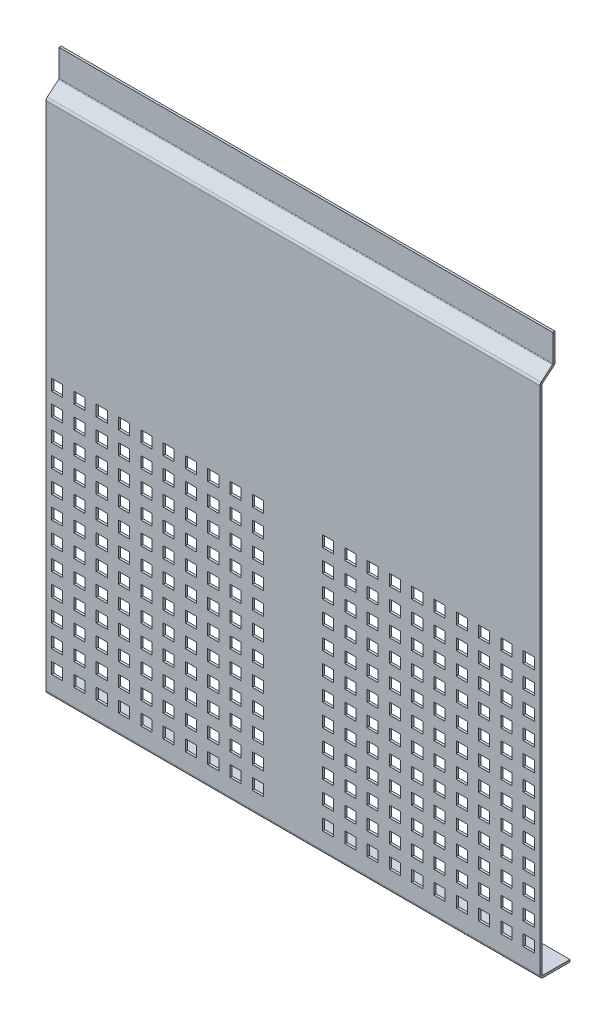
from build123d import *

# Parameters (mm, degrees)
SKETCH1_W                    = 443
SKETCH1_H                    = 500
BASE_FLANGE1_DEPTH           = 2
SKETCHED_START               = -221.5
SKETCHED_BEND1_DEPTH         = 443
SKETCHED_BEND1_2_DEPTH       = 443
SKETCHED_BEND2_DEPTH         = 443
SKETCHED_BEND2_2_DEPTH       = 443
EDGE_FLANGE1_STRIP_W         = 10
EDGE_FLANGE1_STRIP_H         = 2
EDGE_FLANGE1_STRIP_CUT_DEPTH = 443
EDGE_FLANGE1_DEPTH           = 443
SKETCH13_W                   = 10
SKETCH13_H                   = 10
CUT_EXTRUDE2_DEPTH           = 10
SKETCH13_4_W                 = 10
SKETCH13_4_H                 = 10
CUT_EXTRUDE3_DEPTH           = 10
CUT_EXTRUDE4_DEPTH           = 10


# Read off the part's stored shape, not the designer's step: Sketched Bend1, Sketched Bend2
# Sheet-metal steps are written as plain solids
with BuildPart() as part:
    # Sketch1 → Base-Flange1 (new body)
    with BuildSketch(Plane.XY):
        Rectangle(SKETCH1_W, SKETCH1_H)
    extrude(amount=-BASE_FLANGE1_DEPTH)

    # Sketched Bend1 outline → Sketched Bend1 (cut)
    with BuildSketch(Plane.YZ.offset(SKETCHED_START)):
        with BuildLine():
            Line((211.425468703, -1.071637171), (212.20445761, -2))
            Line((212.20445761, -2), (250, -2))
            Line((250, -2), (250, 0))
            Line((250, 0), (209.127335374, 0))
            ThreePointArc((209.127335374, 0), (210.395190159, -0.281076639), (211.425468703, -1.071637171))
        make_face()
    extrude(amount=SKETCHED_BEND1_DEPTH, mode=Mode.SUBTRACT)

    # Sketched Bend1 2 outline → Sketched Bend1 2 (add)
    with BuildSketch(Plane.YZ.offset(SKETCHED_START)):
        with BuildLine():
            Line((209.893379817, -2.35721239), (235.043946196, -32.330490228))
            Line((235.043946196, -32.330490228), (236.576035082, -31.044915008))
            Line((236.576035082, -31.044915008), (212.20445761, -2))
            Line((212.20445761, -2), (209.127335374, -2))
            ThreePointArc((209.127335374, -2), (209.549953636, -2.093692213), (209.893379817, -2.35721239))
        make_face()
    extrude(amount=SKETCHED_BEND1_2_DEPTH)

    # Sketched Bend2 outline → Sketched Bend2 (cut)
    with BuildSketch(Plane.YZ.offset(SKETCHED_START)):
        with BuildLine():
            ThreePointArc((220.711451274, -13.582516433), (219.443596489, -13.301439794), (218.413317944, -12.510879262))
            Line((218.413317944, -12.510879262), (235.043946196, -32.330490228))
            Line((235.043946196, -32.330490228), (236.576035082, -31.044915008))
            Line((236.576035082, -31.044915008), (221.923342878, -13.582516433))
            Line((221.923342878, -13.582516433), (220.711451274, -13.582516433))
        make_face()
    extrude(amount=SKETCHED_BEND2_DEPTH, mode=Mode.SUBTRACT)

    # Sketched Bend2 2 outline → Sketched Bend2 2 (add)
    with BuildSketch(Plane.YZ.offset(SKETCHED_START)):
        with BuildLine():
            Line((219.945406831, -11.225304043), (221.923342878, -13.582516433))
            Line((221.923342878, -13.582516433), (244.838786648, -13.582516433))
            Line((244.838786648, -13.582516433), (244.838786648, -11.582516433))
            Line((244.838786648, -11.582516433), (220.711451274, -11.582516433))
            ThreePointArc((220.711451274, -11.582516433), (220.288833012, -11.48882422), (219.945406831, -11.225304043))
        make_face()
    extrude(amount=SKETCHED_BEND2_2_DEPTH)

    # Edge-Flange1 strip (across the edge) → Edge-Flange1 strip cut (cut)
    with BuildSketch(Plane(origin=(221.5, -250, -2), x_dir=(0, 1, 0), z_dir=(-1, 0, 0))):
        with Locations((-4, -1)):
            Rectangle(EDGE_FLANGE1_STRIP_W, EDGE_FLANGE1_STRIP_H)
    extrude(amount=EDGE_FLANGE1_STRIP_CUT_DEPTH, mode=Mode.SUBTRACT)

    # Edge-Flange1 section (across the edge) → Edge-Flange1 (add)
    with BuildSketch(Plane(origin=(221.5, -250, -2), x_dir=(0, 1, 0), z_dir=(-1, 0, 0))):
        with BuildLine():
            Line((-2, 1), (-2, 25))
            Line((-2, 25), (0, 25))
            Line((0, 25), (0, 1))
            ThreePointArc((0, 1), (0.292893219, 0.292893219), (1, 0))
            Line((1, 0), (1, -2))
            ThreePointArc((1, -2), (-1.121320344, -1.121320344), (-2, 1))
        make_face()
    extrude(amount=EDGE_FLANGE1_DEPTH)

    # Sketch13 → Cut-Extrude2 (cut)
    with BuildSketch(Plane.XY):
        with Locations((-211.5, -9)):
            Rectangle(SKETCH13_W, SKETCH13_H)
        with Locations((-151.5, -9)):
            Rectangle(SKETCH13_W, SKETCH13_H)
        with Locations((-111.5, -9)):
            Rectangle(SKETCH13_W, SKETCH13_H)
        with Locations((-91.5, -9)):
            Rectangle(SKETCH13_W, SKETCH13_H)
        with Locations((-71.5, -9)):
            Rectangle(SKETCH13_W, SKETCH13_H)
        with Locations((-51.5, -9)):
            Rectangle(SKETCH13_W, SKETCH13_H)
        with Locations((-31.5, -9)):
            Rectangle(SKETCH13_W, SKETCH13_H)
        with Locations((-211.5, -29)):
            Rectangle(SKETCH13_W, SKETCH13_H)
        with Locations((-191.5, -29)):
            Rectangle(SKETCH13_W, SKETCH13_H)
        with Locations((-151.5, -29)):
            Rectangle(SKETCH13_W, SKETCH13_H)
        with Locations((-131.5, -29)):
            Rectangle(SKETCH13_W, SKETCH13_H)
        with Locations((-191.5, -9)):
            Rectangle(SKETCH13_W, SKETCH13_H)
        with Locations((-171.5, -9)):
            Rectangle(SKETCH13_W, SKETCH13_H)
        with Locations((-131.5, -9)):
            Rectangle(SKETCH13_W, SKETCH13_H)
        with Locations((-171.5, -29)):
            Rectangle(SKETCH13_W, SKETCH13_H)
        with Locations((-111.5, -29)):
            Rectangle(SKETCH13_W, SKETCH13_H)
    extrude(amount=-CUT_EXTRUDE2_DEPTH, mode=Mode.SUBTRACT)

    # Sketch13<4> → Cut-Extrude3 (cut)
    with BuildSketch(Plane.XY):
        with Locations((-191.5, -9)):
            Rectangle(SKETCH13_4_W, SKETCH13_4_H)
        with Locations((-211.5, -9)):
            Rectangle(SKETCH13_4_W, SKETCH13_4_H)
        with Locations((-171.5, -9)):
            Rectangle(SKETCH13_4_W, SKETCH13_4_H)
        with Locations((-151.5, -9)):
            Rectangle(SKETCH13_4_W, SKETCH13_4_H)
        with Locations((-131.5, -9)):
            Rectangle(SKETCH13_4_W, SKETCH13_4_H)
        with Locations((-111.5, -9)):
            Rectangle(SKETCH13_4_W, SKETCH13_4_H)
        with Locations((-91.5, -9)):
            Rectangle(SKETCH13_4_W, SKETCH13_4_H)
        with Locations((-71.5, -9)):
            Rectangle(SKETCH13_4_W, SKETCH13_4_H)
        with Locations((-51.5, -9)):
            Rectangle(SKETCH13_4_W, SKETCH13_4_H)
        with Locations((-31.5, -9)):
            Rectangle(SKETCH13_4_W, SKETCH13_4_H)
        with Locations((-191.5, -29)):
            Rectangle(SKETCH13_4_W, SKETCH13_4_H)
        with Locations((-171.5, -29)):
            Rectangle(SKETCH13_4_W, SKETCH13_4_H)
        with Locations((-151.5, -29)):
            Rectangle(SKETCH13_4_W, SKETCH13_4_H)
        with Locations((-131.5, -29)):
            Rectangle(SKETCH13_4_W, SKETCH13_4_H)
        with Locations((-111.5, -29)):
            Rectangle(SKETCH13_4_W, SKETCH13_4_H)
        with Locations((-91.5, -29)):
            Rectangle(SKETCH13_4_W, SKETCH13_4_H)
        with Locations((-71.5, -29)):
            Rectangle(SKETCH13_4_W, SKETCH13_4_H)
        with Locations((-51.5, -29)):
            Rectangle(SKETCH13_4_W, SKETCH13_4_H)
        with Locations((-31.5, -29)):
            Rectangle(SKETCH13_4_W, SKETCH13_4_H)
        with Locations((-191.5, -49)):
            Rectangle(SKETCH13_4_W, SKETCH13_4_H)
        with Locations((-171.5, -49)):
            Rectangle(SKETCH13_4_W, SKETCH13_4_H)
        with Locations((-151.5, -49)):
            Rectangle(SKETCH13_4_W, SKETCH13_4_H)
        with Locations((-131.5, -49)):
            Rectangle(SKETCH13_4_W, SKETCH13_4_H)
        with Locations((-111.5, -49)):
            Rectangle(SKETCH13_4_W, SKETCH13_4_H)
        with Locations((-91.5, -49)):
            Rectangle(SKETCH13_4_W, SKETCH13_4_H)
        with Locations((-71.5, -49)):
            Rectangle(SKETCH13_4_W, SKETCH13_4_H)
        with Locations((-51.5, -49)):
            Rectangle(SKETCH13_4_W, SKETCH13_4_H)
        with Locations((-31.5, -49)):
            Rectangle(SKETCH13_4_W, SKETCH13_4_H)
        with Locations((-191.5, -69)):
            Rectangle(SKETCH13_4_W, SKETCH13_4_H)
        with Locations((-171.5, -69)):
            Rectangle(SKETCH13_4_W, SKETCH13_4_H)
        with Locations((-151.5, -69)):
            Rectangle(SKETCH13_4_W, SKETCH13_4_H)
        with Locations((-131.5, -69)):
            Rectangle(SKETCH13_4_W, SKETCH13_4_H)
        with Locations((-111.5, -69)):
            Rectangle(SKETCH13_4_W, SKETCH13_4_H)
        with Locations((-91.5, -69)):
            Rectangle(SKETCH13_4_W, SKETCH13_4_H)
        with Locations((-71.5, -69)):
            Rectangle(SKETCH13_4_W, SKETCH13_4_H)
        with Locations((-51.5, -69)):
            Rectangle(SKETCH13_4_W, SKETCH13_4_H)
        with Locations((-31.5, -69)):
            Rectangle(SKETCH13_4_W, SKETCH13_4_H)
        with Locations((-191.5, -89)):
            Rectangle(SKETCH13_4_W, SKETCH13_4_H)
        with Locations((-171.5, -89)):
            Rectangle(SKETCH13_4_W, SKETCH13_4_H)
        with Locations((-151.5, -89)):
            Rectangle(SKETCH13_4_W, SKETCH13_4_H)
        with Locations((-131.5, -89)):
            Rectangle(SKETCH13_4_W, SKETCH13_4_H)
        with Locations((-111.5, -89)):
            Rectangle(SKETCH13_4_W, SKETCH13_4_H)
        with Locations((-91.5, -89)):
            Rectangle(SKETCH13_4_W, SKETCH13_4_H)
        with Locations((-71.5, -89)):
            Rectangle(SKETCH13_4_W, SKETCH13_4_H)
        with Locations((-51.5, -89)):
            Rectangle(SKETCH13_4_W, SKETCH13_4_H)
        with Locations((-31.5, -89)):
            Rectangle(SKETCH13_4_W, SKETCH13_4_H)
        with Locations((-191.5, -109)):
            Rectangle(SKETCH13_4_W, SKETCH13_4_H)
        with Locations((-171.5, -109)):
            Rectangle(SKETCH13_4_W, SKETCH13_4_H)
        with Locations((-151.5, -109)):
            Rectangle(SKETCH13_4_W, SKETCH13_4_H)
        with Locations((-131.5, -109)):
            Rectangle(SKETCH13_4_W, SKETCH13_4_H)
        with Locations((-111.5, -109)):
            Rectangle(SKETCH13_4_W, SKETCH13_4_H)
        with Locations((-91.5, -109)):
            Rectangle(SKETCH13_4_W, SKETCH13_4_H)
        with Locations((-71.5, -109)):
            Rectangle(SKETCH13_4_W, SKETCH13_4_H)
        with Locations((-51.5, -109)):
            Rectangle(SKETCH13_4_W, SKETCH13_4_H)
        with Locations((-31.5, -109)):
            Rectangle(SKETCH13_4_W, SKETCH13_4_H)
        with Locations((-191.5, -129)):
            Rectangle(SKETCH13_4_W, SKETCH13_4_H)
        with Locations((-171.5, -129)):
            Rectangle(SKETCH13_4_W, SKETCH13_4_H)
        with Locations((-151.5, -129)):
            Rectangle(SKETCH13_4_W, SKETCH13_4_H)
        with Locations((-131.5, -129)):
            Rectangle(SKETCH13_4_W, SKETCH13_4_H)
        with Locations((-111.5, -129)):
            Rectangle(SKETCH13_4_W, SKETCH13_4_H)
        with Locations((-91.5, -129)):
            Rectangle(SKETCH13_4_W, SKETCH13_4_H)
        with Locations((-71.5, -129)):
            Rectangle(SKETCH13_4_W, SKETCH13_4_H)
        with Locations((-51.5, -129)):
            Rectangle(SKETCH13_4_W, SKETCH13_4_H)
        with Locations((-31.5, -129)):
            Rectangle(SKETCH13_4_W, SKETCH13_4_H)
        with Locations((-191.5, -149)):
            Rectangle(SKETCH13_4_W, SKETCH13_4_H)
        with Locations((-171.5, -149)):
            Rectangle(SKETCH13_4_W, SKETCH13_4_H)
        with Locations((-151.5, -149)):
            Rectangle(SKETCH13_4_W, SKETCH13_4_H)
        with Locations((-131.5, -149)):
            Rectangle(SKETCH13_4_W, SKETCH13_4_H)
        with Locations((-111.5, -149)):
            Rectangle(SKETCH13_4_W, SKETCH13_4_H)
        with Locations((-91.5, -149)):
            Rectangle(SKETCH13_4_W, SKETCH13_4_H)
        with Locations((-71.5, -149)):
            Rectangle(SKETCH13_4_W, SKETCH13_4_H)
        with Locations((-51.5, -149)):
            Rectangle(SKETCH13_4_W, SKETCH13_4_H)
        with Locations((-31.5, -149)):
            Rectangle(SKETCH13_4_W, SKETCH13_4_H)
        with Locations((-191.5, -169)):
            Rectangle(SKETCH13_4_W, SKETCH13_4_H)
        with Locations((-171.5, -169)):
            Rectangle(SKETCH13_4_W, SKETCH13_4_H)
        with Locations((-151.5, -169)):
            Rectangle(SKETCH13_4_W, SKETCH13_4_H)
        with Locations((-131.5, -169)):
            Rectangle(SKETCH13_4_W, SKETCH13_4_H)
        with Locations((-111.5, -169)):
            Rectangle(SKETCH13_4_W, SKETCH13_4_H)
        with Locations((-91.5, -169)):
            Rectangle(SKETCH13_4_W, SKETCH13_4_H)
        with Locations((-71.5, -169)):
            Rectangle(SKETCH13_4_W, SKETCH13_4_H)
        with Locations((-51.5, -169)):
            Rectangle(SKETCH13_4_W, SKETCH13_4_H)
        with Locations((-31.5, -169)):
            Rectangle(SKETCH13_4_W, SKETCH13_4_H)
        with Locations((-191.5, -189)):
            Rectangle(SKETCH13_4_W, SKETCH13_4_H)
        with Locations((-171.5, -189)):
            Rectangle(SKETCH13_4_W, SKETCH13_4_H)
        with Locations((-151.5, -189)):
            Rectangle(SKETCH13_4_W, SKETCH13_4_H)
        with Locations((-131.5, -189)):
            Rectangle(SKETCH13_4_W, SKETCH13_4_H)
        with Locations((-111.5, -189)):
            Rectangle(SKETCH13_4_W, SKETCH13_4_H)
        with Locations((-91.5, -189)):
            Rectangle(SKETCH13_4_W, SKETCH13_4_H)
        with Locations((-71.5, -189)):
            Rectangle(SKETCH13_4_W, SKETCH13_4_H)
        with Locations((-51.5, -189)):
            Rectangle(SKETCH13_4_W, SKETCH13_4_H)
        with Locations((-31.5, -189)):
            Rectangle(SKETCH13_4_W, SKETCH13_4_H)
        with Locations((-191.5, -209)):
            Rectangle(SKETCH13_4_W, SKETCH13_4_H)
        with Locations((-171.5, -209)):
            Rectangle(SKETCH13_4_W, SKETCH13_4_H)
        with Locations((-151.5, -209)):
            Rectangle(SKETCH13_4_W, SKETCH13_4_H)
        with Locations((-131.5, -209)):
            Rectangle(SKETCH13_4_W, SKETCH13_4_H)
        with Locations((-111.5, -209)):
            Rectangle(SKETCH13_4_W, SKETCH13_4_H)
        with Locations((-91.5, -209)):
            Rectangle(SKETCH13_4_W, SKETCH13_4_H)
        with Locations((-71.5, -209)):
            Rectangle(SKETCH13_4_W, SKETCH13_4_H)
        with Locations((-51.5, -209)):
            Rectangle(SKETCH13_4_W, SKETCH13_4_H)
        with Locations((-31.5, -209)):
            Rectangle(SKETCH13_4_W, SKETCH13_4_H)
        with Locations((-191.5, -229)):
            Rectangle(SKETCH13_4_W, SKETCH13_4_H)
        with Locations((-171.5, -229)):
            Rectangle(SKETCH13_4_W, SKETCH13_4_H)
        with Locations((-151.5, -229)):
            Rectangle(SKETCH13_4_W, SKETCH13_4_H)
        with Locations((-131.5, -229)):
            Rectangle(SKETCH13_4_W, SKETCH13_4_H)
        with Locations((-111.5, -229)):
            Rectangle(SKETCH13_4_W, SKETCH13_4_H)
        with Locations((-91.5, -229)):
            Rectangle(SKETCH13_4_W, SKETCH13_4_H)
        with Locations((-71.5, -229)):
            Rectangle(SKETCH13_4_W, SKETCH13_4_H)
        with Locations((-51.5, -229)):
            Rectangle(SKETCH13_4_W, SKETCH13_4_H)
        with Locations((-31.5, -229)):
            Rectangle(SKETCH13_4_W, SKETCH13_4_H)
        with Locations((-211.5, -29)):
            Rectangle(SKETCH13_4_W, SKETCH13_4_H)
        with Locations((-211.5, -49)):
            Rectangle(SKETCH13_4_W, SKETCH13_4_H)
        with Locations((-211.5, -69)):
            Rectangle(SKETCH13_4_W, SKETCH13_4_H)
        with Locations((-211.5, -89)):
            Rectangle(SKETCH13_4_W, SKETCH13_4_H)
        with Locations((-211.5, -109)):
            Rectangle(SKETCH13_4_W, SKETCH13_4_H)
        with Locations((-211.5, -129)):
            Rectangle(SKETCH13_4_W, SKETCH13_4_H)
        with Locations((-211.5, -149)):
            Rectangle(SKETCH13_4_W, SKETCH13_4_H)
        with Locations((-211.5, -169)):
            Rectangle(SKETCH13_4_W, SKETCH13_4_H)
        with Locations((-211.5, -189)):
            Rectangle(SKETCH13_4_W, SKETCH13_4_H)
        with Locations((-211.5, -209)):
            Rectangle(SKETCH13_4_W, SKETCH13_4_H)
        with Locations((-211.5, -229)):
            Rectangle(SKETCH13_4_W, SKETCH13_4_H)
    cut_extrude3 = extrude(amount=-CUT_EXTRUDE3_DEPTH, mode=Mode.SUBTRACT)

    # Mirror1: Cut-Extrude3 across plane
    add(cut_extrude3.mirror(Plane.ZY), mode=Mode.SUBTRACT)

    # Sketch12 → Cut-Extrude4 (cut)
    with BuildSketch(Plane.XZ.offset(252)):
        with BuildLine():
            ThreePointArc((2.5, -22), (1.767766953, -20.232233047), (0, -19.5))
            Line((0, -19.5), (0, -24.5))
            ThreePointArc((0, -24.5), (1.767766953, -23.767766953), (2.5, -22))
        make_face()
        with BuildLine():
            Line((0, -24.5), (0, -19.5))
            ThreePointArc((0, -19.5), (-2.5, -22), (0, -24.5))
        make_face()
    extrude(amount=-CUT_EXTRUDE4_DEPTH, mode=Mode.SUBTRACT)


solid = part.part
